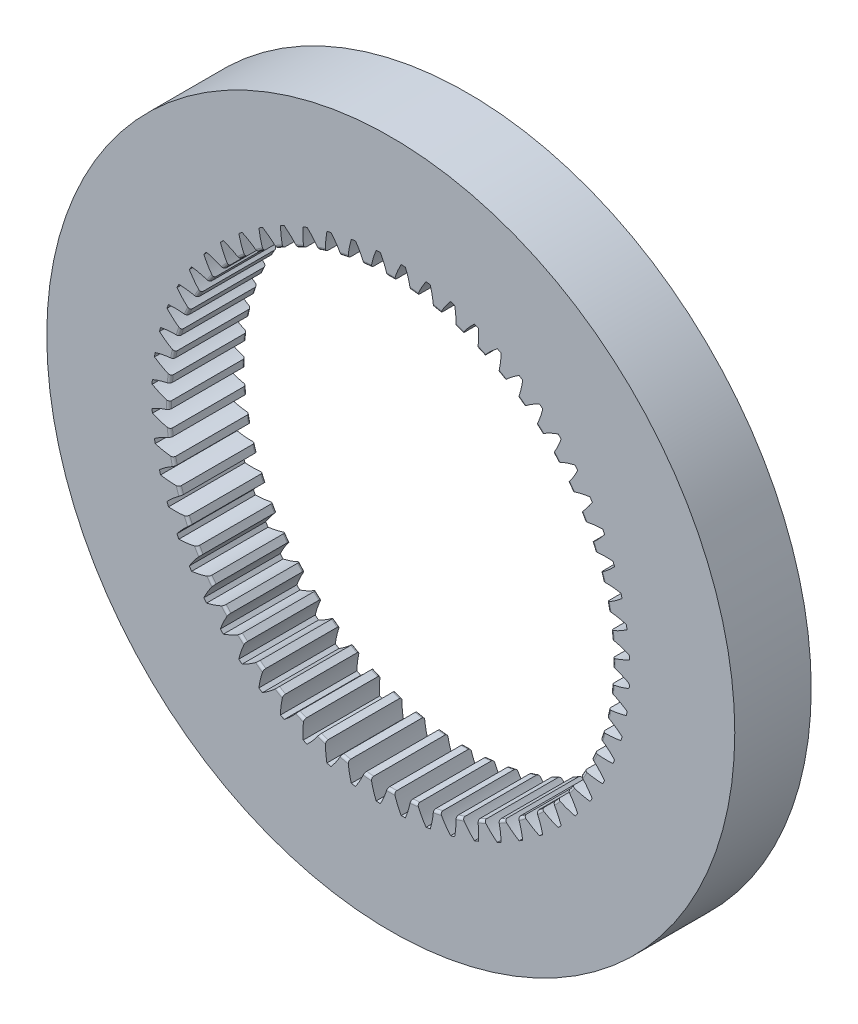
from build123d import *

# Parameters (mm, degrees)
BOSS_EXTRUDE1_DEPTH      = 5
BOSS_EXTRUDE1_DEPTH_BACK = 5
SKETCH3_R                = 45
SKETCH3_R_2              = 29
FILLET1_R                = 0.335505036
CUT_EXTRUDE1_DEPTH       = 64.835726682
FILLET2_R                = 0.335505036
CIRPATTERN1_COUNT        = 60


with BuildPart() as part:
    # Sketch3 → Boss-Extrude1 (new, two sides: drawn at the far end of the back side and taken through both)
    with BuildSketch(Plane.XY.offset(-BOSS_EXTRUDE1_DEPTH_BACK)):
        Circle(SKETCH3_R)
        Circle(SKETCH3_R_2, mode=Mode.SUBTRACT)
    extrude(amount=BOSS_EXTRUDE1_DEPTH + BOSS_EXTRUDE1_DEPTH_BACK)

    # Fillet1
    fillet1_edges = [part.edges().sort_by_distance(p)[0] for p in [
        (-29, 0, -5),
        (-29, 0, 5),
    ]]
    fillet(fillet1_edges, radius=FILLET1_R)

    # Sketch4 → Cut-Extrude1 (cut, symmetric)
    with BuildSketch(Plane.XY):
        with BuildLine():
            ThreePointArc((31.220511032, -1.357273328), (31.207172961, -1.635498633), (31.191355501, -1.913593998))
            add(Edge.make_bspline(
                [(28.067789774, -2.630432781), (28.072542292, -2.630829705), (28.085885576, -2.631794112), (28.11116526, -2.633029417), (28.152489458, -2.634209622), (28.205249387, -2.634484623), (28.27355986, -2.633428107), (28.354175984, -2.630366221), (28.442916981, -2.625096025), (28.539613762, -2.617304263), (28.636209507, -2.607709711), (28.732680395, -2.596442114), (28.828876984, -2.583686832), (28.945508974, -2.56642511), (29.085505821, -2.543208597), (29.249333204, -2.51239884), (29.435351723, -2.473118319), (29.625145618, -2.428440079), (29.812066931, -2.380658498), (30.001095746, -2.327985108), (30.184110268, -2.273905941), (30.374361069, -2.213223172), (30.550050605, -2.154916866), (30.747038702, -2.084593253), (30.906054903, -2.026382865), (31.070432887, -1.962077652), (31.150453313, -1.93016371), (31.191355501, -1.913593998)],
                knots=[0, 0, 0, 0, 0, 0.005376749, 0.015083688, 0.02853182, 0.04661014, 0.064854849, 0.092110526, 0.119476176, 0.146842496, 0.174208854, 0.201574956, 0.228941013, 0.256307345, 0.307035032, 0.361767352, 0.416499661, 0.471231937, 0.525964282, 0.580696616, 0.635428982, 0.690161387, 0.744893688, 0.799626082, 0.854358407, 0.909090914, 0.909090914, 0.909090914, 0.909090914, 0.909090914], degree=4))
            ThreePointArc((28.067789774, -2.630432781), (28.152144141, -1.475391356), (28.188986581, -0.317859937))
            add(Edge.make_bspline(
                [(28.188986581, -0.317859937), (28.193754555, -0.317961962), (28.207125551, -0.318397591), (28.232395875, -0.319811499), (28.273617059, -0.322957314), (28.326116709, -0.328198734), (28.393942534, -0.336389851), (28.473796981, -0.347861643), (28.561500959, -0.362378929), (28.656853564, -0.380235572), (28.751917244, -0.399874569), (28.846681869, -0.421164395), (28.941018194, -0.443905083), (29.05520692, -0.473263606), (29.192010063, -0.510986593), (29.351719486, -0.558752195), (29.532613044, -0.617261764), (29.71669708, -0.681534115), (29.897599883, -0.748592541), (30.08008731, -0.820736272), (30.256446447, -0.893649415), (30.439311958, -0.973886381), (30.607944379, -1.050237836), (30.796502536, -1.140767072), (30.948562988, -1.215280297), (31.105318766, -1.296415418), (31.181564917, -1.336518944), (31.220511032, -1.357273328)],
                knots=[0, 0, 0, 0, 0, 0.005376749, 0.015083688, 0.02853182, 0.04661014, 0.064854849, 0.092110526, 0.119476176, 0.146842496, 0.174208854, 0.201574956, 0.228941013, 0.256307345, 0.307035032, 0.361767352, 0.416499661, 0.471231937, 0.525964282, 0.580696616, 0.635428982, 0.690161387, 0.744893688, 0.799626082, 0.854358407, 0.909090914, 0.909090914, 0.909090914, 0.909090914, 0.909090914], degree=4))
        make_face()
    cut_extrude1 = extrude(amount=CUT_EXTRUDE1_DEPTH, both=True, mode=Mode.SUBTRACT)

    # Fillet2
    fillet2_edges = [part.edges().sort_by_distance(p)[0] for p in [
        (31.191355501, -1.913593998, 2.5),
        (31.220511032, -1.357273328, 2.5),
    ]]
    fillet(fillet2_edges, radius=FILLET2_R)

    # CirPattern1: Cut-Extrude1 ×60 about axis
    cirpattern1_axis = Axis((0, 0, 5), (0, 0, -1))
    for i in range(1, CIRPATTERN1_COUNT):
        add(cut_extrude1.rotate(cirpattern1_axis, i * 360 / CIRPATTERN1_COUNT), mode=Mode.SUBTRACT)


solid = part.part
